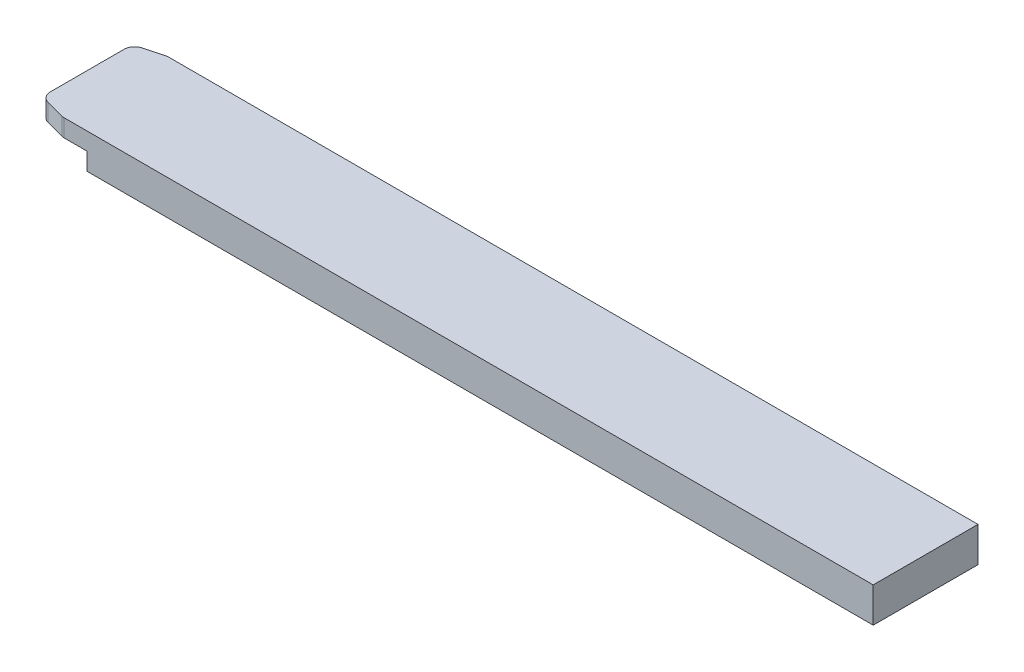
from build123d import *

# Parameters (mm, degrees)
EXTRUDE_1_DEPTH     = 10
SKETCH_4_W          = 15
SKETCH_4_H          = 30
CUT_EXTRUDE_2_DEPTH = 5
FILLET_1_R          = 3


with BuildPart() as part:
    # Эскиз1 → Бобышка-Вытянуть1 (new body)
    with BuildSketch(Plane(origin=(0, 0, 0), x_dir=(1, 0, 0), z_dir=(0, 1, 0))):
        Polygon((15, 0), (240, 0), (240, 30), (15, 30), (8, 30), (0, 27.856406461), (0, 2.143593539), (8, 0), align=None)
    extrude(amount=EXTRUDE_1_DEPTH)

    # Эскиз4 → Вырез-Вытянуть2 (cut)
    with BuildSketch(Plane.XZ):
        with Locations((7.5, -15)):
            Rectangle(SKETCH_4_W, SKETCH_4_H)
    extrude(amount=-CUT_EXTRUDE_2_DEPTH, mode=Mode.SUBTRACT)

    # Скругление1
    fillet_1_edges = [part.edges().sort_by_distance(p)[0] for p in [
        (8, 7.5, -30),
        (0, 7.5, -27.856406461),
        (0, 7.5, -2.143593539),
        (8, 7.5, 0),
    ]]
    fillet(fillet_1_edges, radius=FILLET_1_R)


solid = part.part
